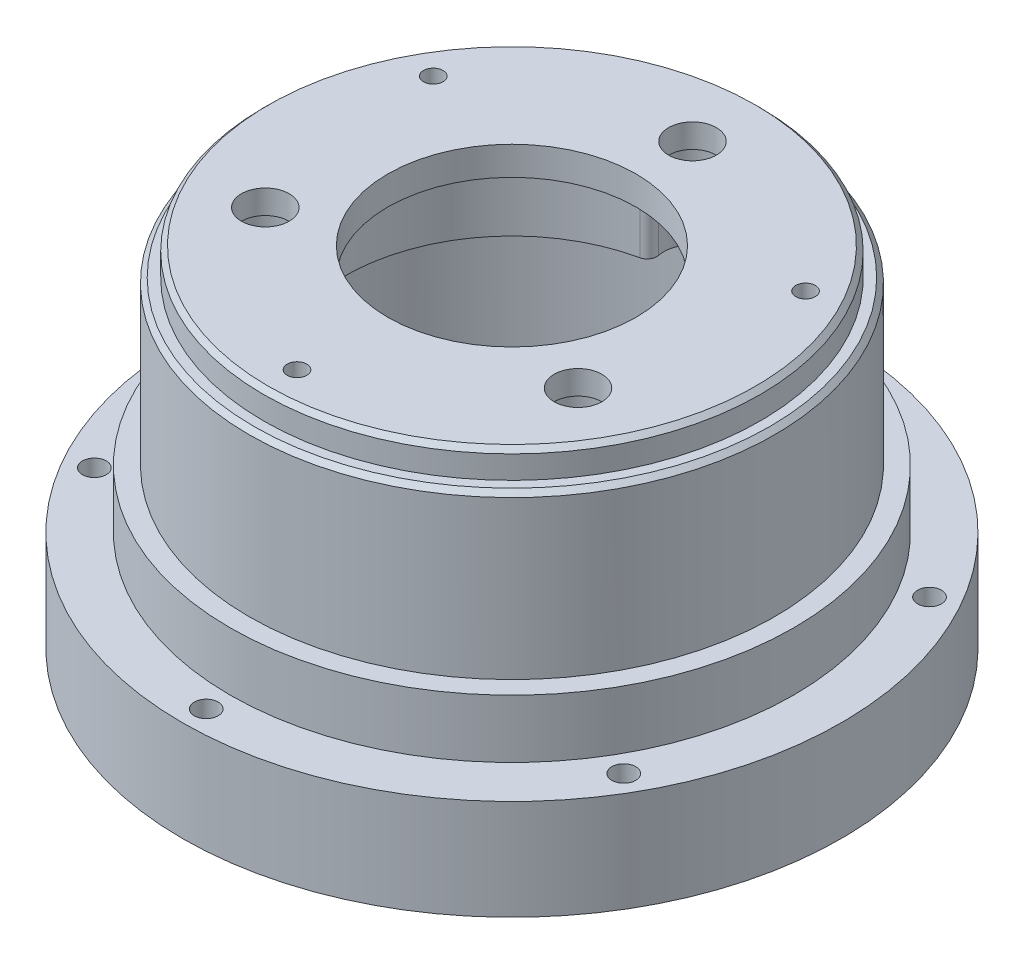
from build123d import *

# Parameters (mm, degrees)
SKETCH_2_R               = 2.5
CUT_EXTRUDE_1_DEPTH      = 61.932339525
HOLE_WIZARD_M2_5_5_D     = 2.05
HOLE_WIZARD_M2_5_5_DEPTH = 18.35
HOLE_WIZARD_M2_5_5_TIP   = 0.615882135
CHAMFER_1_SIZE           = 0.5
CUT_EXTRUDE_START        = -9
SKETCH_20_R              = 3
SKETCH_20_R_2            = 2.5
CUT_EXTRUDE_6_DEPTH      = 9
HOLE_WIZARD_M3_2_D       = 2.5
HOLE_WIZARD_M3_2_DEPTH   = 18.5
HOLE_WIZARD_M3_2_TIP     = 0.751075774
SKETCH_25_R              = 28
SKETCH_25_R_2            = 26
EXTRUDE_1_DEPTH          = 1
FILLET_1_R               = 1


with BuildPart() as part:
    # 草图1 → 旋转1 (revolve)
    with BuildSketch(Plane.XY):
        Polygon((26, -11.5), (26, -36.5), (34.5, -36.5), (34.5, -26), (29.5, -26), (29.5, -19.9), (27.5, -19.9), (27.5, -2.9), (26, -2.9), (26, 0), (13, 0), (13, -3), (15.5, -3), (15.5, -4.5), (17.5, -4.5), (17.5, -11.5), align=None)
    revolve(axis=Axis((0, 53.635658915, 0), (0, -1, 0)))

    # 草图2 → 切除-拉伸1 (cut, through all)
    with BuildSketch(Plane(origin=(0, 0, 0), x_dir=(1, 0, 0), z_dir=(0, 1, 0))):
        with Locations((0, 18.9)):
            Circle(SKETCH_2_R)
        with Locations((-16.367880132, -9.45)):
            Circle(SKETCH_2_R)
        with Locations((16.367880132, -9.45)):
            Circle(SKETCH_2_R)
    extrude(amount=-CUT_EXTRUDE_1_DEPTH, mode=Mode.SUBTRACT)

    # M2.5 螺纹孔5
    with Locations(Plane(origin=(-19.485571585, 0, -11.25), x_dir=(0, 0, 1), z_dir=(0, 1, 0))):
        with Locations((0, 0), (0, 38.97114317), (33.75, 19.485571585)):
            Hole(HOLE_WIZARD_M2_5_5_D / 2, depth=HOLE_WIZARD_M2_5_5_DEPTH)
            with Locations((0, 0, -(HOLE_WIZARD_M2_5_5_DEPTH + HOLE_WIZARD_M2_5_5_TIP / 2))):  # 118° drill point
                Cone(0, HOLE_WIZARD_M2_5_5_D / 2, HOLE_WIZARD_M2_5_5_TIP, mode=Mode.SUBTRACT)

    # 倒角1
    chamfer_1_edges = [part.edges().sort_by_distance(p)[0] for p in [
        (-27.5, -2.9, 0),
        (-26, 0, 0),
    ]]
    chamfer(chamfer_1_edges, length=CHAMFER_1_SIZE)

    # 草图20 → 切除-拉伸6 (cut)
    # profile 1 of 3: a face of its own
    with BuildSketch(Plane.XZ.offset(11.5).offset(CUT_EXTRUDE_START)):
        with Locations((-16.367880132, 9.45)):
            Circle(SKETCH_20_R)
        with Locations((-16.367880132, 9.45)):
            Circle(SKETCH_20_R_2, mode=Mode.SUBTRACT)
    # profile 2 of 3: a face of its own
    with BuildSketch(Plane.XZ.offset(11.5).offset(CUT_EXTRUDE_START)):
        with Locations((16.367880132, 9.45)):
            Circle(SKETCH_20_R)
        with Locations((16.367880132, 9.45)):
            Circle(SKETCH_20_R_2, mode=Mode.SUBTRACT)
    # profile 3 of 3: a face of its own
    with BuildSketch(Plane.XZ.offset(11.5).offset(CUT_EXTRUDE_START)):
        with Locations((0, -18.9)):
            Circle(SKETCH_20_R)
        with Locations((0, -18.9)):
            Circle(SKETCH_20_R_2, mode=Mode.SUBTRACT)
    extrude(amount=CUT_EXTRUDE_6_DEPTH, mode=Mode.SUBTRACT)

    # M3 螺纹孔2
    with Locations(Plane(origin=(0, -26, 0), x_dir=(1, 0, 0), z_dir=(0, 1, 0))):
        with Locations((-27.712812921, 16), (-27.712812921, -16), (0, -32), (27.712812921, -16), (27.712812921, 16), (0, 32)):
            Hole(HOLE_WIZARD_M3_2_D / 2, depth=HOLE_WIZARD_M3_2_DEPTH)
            with Locations((0, 0, -(HOLE_WIZARD_M3_2_DEPTH + HOLE_WIZARD_M3_2_TIP / 2))):  # 118° drill point
                Cone(0, HOLE_WIZARD_M3_2_D / 2, HOLE_WIZARD_M3_2_TIP, mode=Mode.SUBTRACT)

    # 草图25 → 凸台-拉伸1 (add)
    with BuildSketch(Plane.XZ.offset(36.5)):
        Circle(SKETCH_25_R)
        Circle(SKETCH_25_R_2, mode=Mode.SUBTRACT)
    extrude(amount=EXTRUDE_1_DEPTH)

    # 圆角1
    fillet_1_edges = [part.edges().sort_by_distance(p)[0] for p in [
        (2.546336961, -8, -17.313756614),
        (-2.546336961, -8, -17.313756614),
        (13.720984582, -8, 10.862070802),
        (-13.720984582, -8, 10.862070802),
        (-16.267321543, -8, 6.451685812),
        (16.267321543, -8, 6.451685812),
    ]]
    fillet(fillet_1_edges, radius=FILLET_1_R)


solid = part.part
